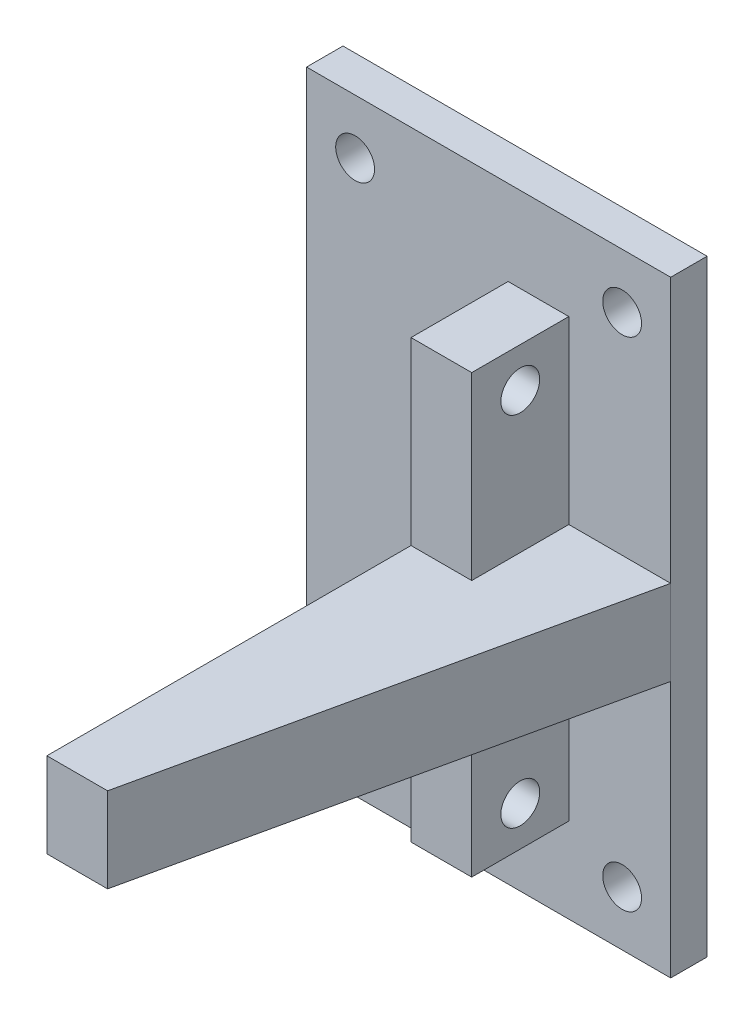
from build123d import *

# Parameters (mm, degrees)
SKETCH_1_W          = 30
SKETCH_1_H          = 50
SKETCH_1_R          = 1.6
EXTRUDE_1_DEPTH     = 3
SKETCH_2_W          = 5
SKETCH_2_H          = 36
EXTRUDE_2_DEPTH     = 8
SKETCH_5_R          = 1.6
CUT_EXTRUDE_1_DEPTH = 10
SKETCH_6_W          = 5
SKETCH_6_H          = 7
EXTRUDE_3_DEPTH     = 30
RIB_1_REACH         = 65.828
SKETCH_7_WALL_W     = 168.57168005
SKETCH_7_WALL_H     = 7


with BuildPart() as part:
    # 草图1 → 凸台-拉伸1 (new body)
    with BuildSketch(Plane.XY):
        with Locations((-25, -15)):
            Rectangle(SKETCH_1_W, SKETCH_1_H)
        with Locations((-14, 5.5)):
            Circle(SKETCH_1_R, mode=Mode.SUBTRACT)
        with Locations((-36, -35.5)):
            Circle(SKETCH_1_R, mode=Mode.SUBTRACT)
        with Locations((-14, -35.5)):
            Circle(SKETCH_1_R, mode=Mode.SUBTRACT)
        with Locations((-36, 5.5)):
            Circle(SKETCH_1_R, mode=Mode.SUBTRACT)
    extrude(amount=EXTRUDE_1_DEPTH)

    # 草图2 → 凸台-拉伸2 (add)
    with BuildSketch(Plane.XY.offset(3)):
        with Locations((-20.894219559, -15)):
            Rectangle(SKETCH_2_W, SKETCH_2_H)
    extrude(amount=EXTRUDE_2_DEPTH)

    # 草图5 → 切除-拉伸1 (cut)
    with BuildSketch(Plane(origin=(-18.394219559, 0, 0), x_dir=(0, 0, -1), z_dir=(1, 0, 0))):
        with Locations((-7, -0.268)):
            Circle(SKETCH_5_R)
        with Locations((-7, -29.732)):
            Circle(SKETCH_5_R)
    extrude(amount=-CUT_EXTRUDE_1_DEPTH, mode=Mode.SUBTRACT)

    # 草图6 → 凸台-拉伸3 (add)
    with BuildSketch(Plane.XY.offset(11)):
        with Locations((-20.894219559, -15.339980262)):
            Rectangle(SKETCH_6_W, SKETCH_6_H)
    extrude(amount=EXTRUDE_3_DEPTH)

    # 草图7 wall → 筋1 (add, up to next)
    with BuildSketch(Plane(origin=(-14.197109779, -11.839980262, 22), x_dir=(0.215700425519, 0, -0.97645958771), z_dir=(-0.97645958771, 0, -0.215700425519)), mode=Mode.PRIVATE) as rib_1_sk1:
        with Locations((0, 3.5)):
            Rectangle(SKETCH_7_WALL_W, SKETCH_7_WALL_H)
    rib_1_tool1 = extrude(rib_1_sk1.sketch, amount=RIB_1_REACH, mode=Mode.PRIVATE) - part.part
    add(rib_1_tool1.solids().sort_by_distance((-14.197109779, -11.839980262, 22))[0])


solid = part.part
